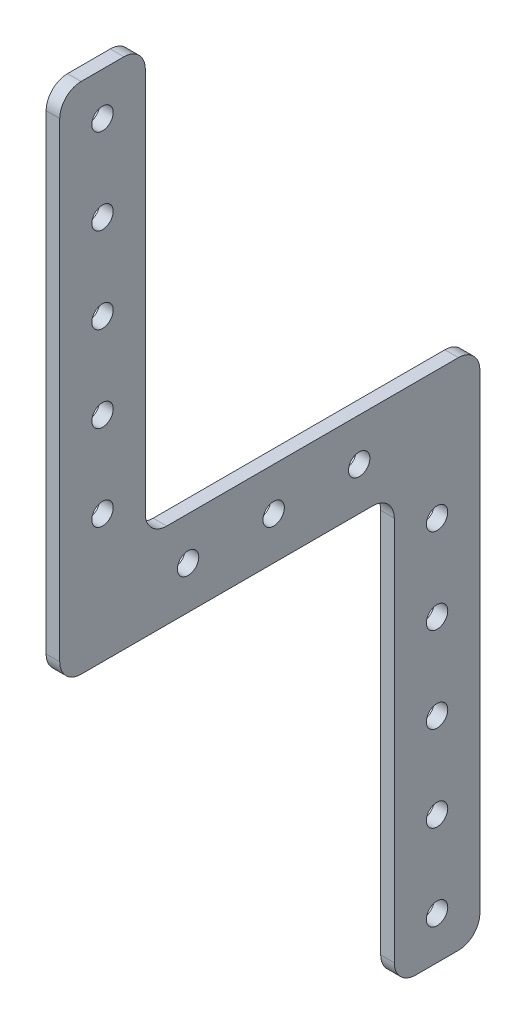
from build123d import *

# Parameters (mm, degrees)
SKETCH2_R           = 2.5
BOSS_EXTRUDE1_DEPTH = 3.175
FILLET1_R           = 5


with BuildPart() as part:
    # Sketch2 → Boss-Extrude1 (new body)
    with BuildSketch(Plane(origin=(0, 0, 0), x_dir=(0, 0, -1), z_dir=(1, 0, 0))):
        Polygon((-49.1, 110), (-29.1, 110), (-29.1, 10), (49.1, 10), (49.1, -110), (29.1, -110), (29.1, -10), (-49.1, -10), align=None)
        with Locations((-39.1, 100)):
            Circle(SKETCH2_R, mode=Mode.SUBTRACT)
        with Locations((-39.1, 80)):
            Circle(SKETCH2_R, mode=Mode.SUBTRACT)
        with Locations((-39.1, 60)):
            Circle(SKETCH2_R, mode=Mode.SUBTRACT)
        with Locations((-39.1, 40)):
            Circle(SKETCH2_R, mode=Mode.SUBTRACT)
        with Locations((-39.1, 20)):
            Circle(SKETCH2_R, mode=Mode.SUBTRACT)
        with Locations((39.1, -100)):
            Circle(SKETCH2_R, mode=Mode.SUBTRACT)
        with Locations((39.1, -80)):
            Circle(SKETCH2_R, mode=Mode.SUBTRACT)
        with Locations((39.1, -60)):
            Circle(SKETCH2_R, mode=Mode.SUBTRACT)
        with Locations((39.1, -40)):
            Circle(SKETCH2_R, mode=Mode.SUBTRACT)
        with Locations((39.1, -20)):
            Circle(SKETCH2_R, mode=Mode.SUBTRACT)
        with Locations((-19.1, 0)):
            Circle(SKETCH2_R, mode=Mode.SUBTRACT)
        with Locations((0.9, 0)):
            Circle(SKETCH2_R, mode=Mode.SUBTRACT)
        with Locations((20.9, 0)):
            Circle(SKETCH2_R, mode=Mode.SUBTRACT)
    extrude(amount=BOSS_EXTRUDE1_DEPTH)

    # Fillet1
    fillet1_edges = [part.edges().sort_by_distance(p)[0] for p in [
        (1.5875, -110, -49.1),
        (1.5875, -110, -29.1),
        (1.5875, -10, -29.1),
        (1.5875, 10, -49.1),
        (1.5875, 10, 29.1),
        (1.5875, -10, 49.1),
        (1.5875, 110, 29.1),
        (1.5875, 110, 49.1),
    ]]
    fillet(fillet1_edges, radius=FILLET1_R)


solid = part.part
